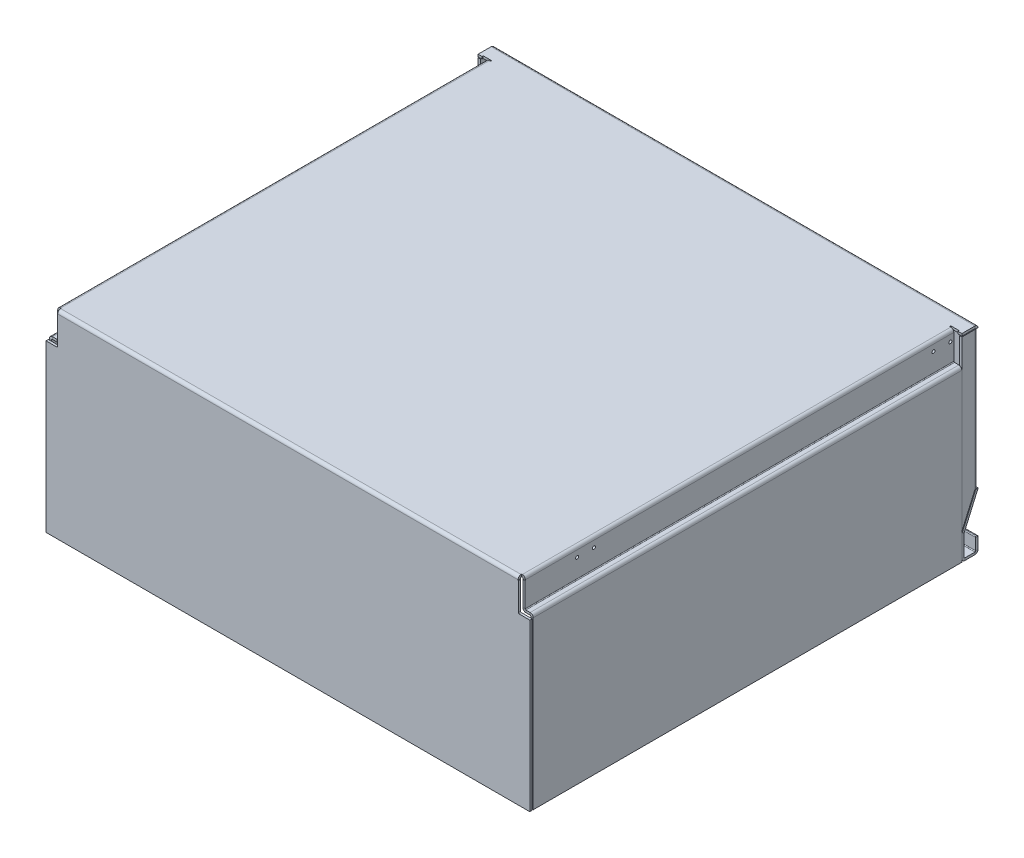
from build123d import *

# Parameters (mm, degrees)
DODANIE_WYCI_GNI_CIE1_DEPTH         = 565
DODANIE_WYCI_GNI_CIE2_DEPTH         = 632.58
KONWERTUJ_START                     = -896.862154084
KONWERTUJ_BRY_3_DEPTH               = 603.42
KONWERTUJ_START_2                   = -911.442154084
KONWERTUJ_BRY_3_2_DEPTH             = 632.58
KONWERTUJ_START_3                   = -566.5
KONWERTUJ_BRY_3_3_DEPTH             = 567.5
KONWERTUJ_START_4                   = -4.414213562
KONWERTUJ_BRY_3_4_DEPTH             = 5.414213562
KONWERTUJ_BRY_3_5_DEPTH             = 1.5
KONWERTUJ_START_5                   = -4.75
KONWERTUJ_BRY_3_6_DEPTH             = 0.335786438
KONWERTUJ_START_6                   = -565
KONWERTUJ_BRY_3_7_DEPTH             = 560.585786438
KONWERTUJ_START_7                   = -912
KONWERTUJ_BRY_3_8_DEPTH             = 634
KONWERTUJ_BRY_3_9_DEPTH             = 632.58
ODGI_CIE_KRAW_DZI1_STRIP_W          = 14
ODGI_CIE_KRAW_DZI1_STRIP_H          = 3
ODGI_CIE_KRAW_DZI1_STRIP_CUT_DEPTH  = 560.485786438
ODGI_CIE_KRAW_DZI1_RELIEF_W         = 15.5
ODGI_CIE_KRAW_DZI1_RELIEF_H         = 1.5
ODGI_CIE_KRAW_DZI1_RELIEF_CUT_DEPTH = 3
ODGI_CIE_KRAW_DZI1_DEPTH            = 560.485786438
ODGI_CIE_KRAW_DZI2_STRIP_W          = 14
ODGI_CIE_KRAW_DZI2_STRIP_H          = 3
ODGI_CIE_KRAW_DZI2_STRIP_CUT_DEPTH  = 560.485786438
ODGI_CIE_KRAW_DZI2_RELIEF_W         = 15.5
ODGI_CIE_KRAW_DZI2_RELIEF_H         = 1.5
ODGI_CIE_KRAW_DZI2_RELIEF_CUT_DEPTH = 3
ODGI_CIE_KRAW_DZI2_DEPTH            = 560.485786438
ODGI_CIE_KRAW_DZI3_STRIP_W          = 14
ODGI_CIE_KRAW_DZI3_STRIP_H          = 3
ODGI_CIE_KRAW_DZI3_STRIP_CUT_DEPTH  = 181.160616366
ODGI_CIE_KRAW_DZI3_DEPTH            = 181.160616366
DODANIE_WYCI_GNI_CIE9_DEPTH         = 3
ODGI_CIE_KRAW_DZI4_STRIP_W          = 14
ODGI_CIE_KRAW_DZI4_STRIP_H          = 3
ODGI_CIE_KRAW_DZI4_STRIP_CUT_DEPTH  = 181.160616366
ODGI_CIE_KRAW_DZI4_DEPTH            = 181.160616366
DODANIE_WYCI_GNI_CIE10_DEPTH        = 3
ZAOKR_GLENIE1_R                     = 1
SZKIC42_R                           = 2
WYTNIJ_WYCI_GNI_CIE1_DEPTH          = 888.463636929


with BuildPart() as part:
    # Szkic1 → Dodanie-wyciągnięcie1 (new body)
    with BuildSketch(Plane.XY):
        Polygon((-289.442154084, 19.601364099), (-289.442154084, -18), (-278.862154084, -18), (-278.862154084, -239.398635901), (-911.442154084, -239.398635901), (-911.442154084, -18), (-900.862154084, -18), (-900.862154084, 19.601364099), align=None)
    extrude(amount=-DODANIE_WYCI_GNI_CIE1_DEPTH)

    # Szkic2 → Dodanie-wyciągnięcie2 (add)
    with BuildSketch(Plane.ZY.offset(911.442154084)):
        Polygon((-565, 19.601364099), (-586, 19.601364099), (-586, -166.398635901), (-568, -207.398635901), (-568, -219.398635901), (-568, -236.398635901), (-583, -236.398635901), (-583, -219.398635901), (-586, -219.398635901), (-586, -239.398635901), (-565, -239.398635901), align=None)
    extrude(amount=-DODANIE_WYCI_GNI_CIE2_DEPTH)

    # Konwertuj bryłę3: read off the stored shape, not the designer's step
    # Konwertuj bryłę3 outline → Konwertuj bryłę3 (cut)
    with BuildSketch(Plane.YZ.offset(KONWERTUJ_START)):
        with BuildLine():
            ThreePointArc((16.601364099, -4), (16.30847088, -3.292893219), (15.601364099, -3))
            Line((15.601364099, -3), (-239.398635901, -3))
            Line((-239.398635901, -3), (-239.398635901, -569))
            ThreePointArc((-239.398635901, -569), (-238.227063026, -566.171572875), (-235.398635901, -565))
            Line((-235.398635901, -565), (-207.60848181, -565))
            ThreePointArc((-207.60848181, -565), (-206.78699063, -565.085264729), (-206.000521562, -565.337423879))
            Line((-206.000521562, -565.337423879), (-165.961242329, -582.91564403))
            ThreePointArc((-165.961242329, -582.91564403), (-165.764625062, -582.978683818), (-165.559252267, -583))
            Line((-165.559252267, -583), (15.601364099, -583))
            ThreePointArc((15.601364099, -583), (16.30847088, -582.707106781), (16.601364099, -582))
            Line((16.601364099, -582), (16.601364099, -4))
        make_face()
        with BuildLine():
            ThreePointArc((-235.398635901, -586), (-238.227063026, -584.828427125), (-239.398635901, -582))
            Line((-239.398635901, -582), (-239.398635901, -586))
            Line((-239.398635901, -586), (-235.398635901, -586))
        make_face()
    extrude(amount=KONWERTUJ_BRY_3_DEPTH, mode=Mode.SUBTRACT)

    # Konwertuj bry_3 2 outline → Konwertuj bry_3 2 (cut)
    with BuildSketch(Plane.YZ.offset(KONWERTUJ_START_2)):
        with BuildLine():
            Line((16.601364099, -565), (-21, -565))
            Line((-21, -565), (-21, -4.414213562))
            Line((-21, -4.414213562), (14.851364099, -4.414213562))
            Line((14.851364099, -4.414213562), (14.851364099, -4.75))
            Line((14.851364099, -4.75), (16.601364099, -4.75))
            Line((16.601364099, -4.75), (16.601364099, -4))
            ThreePointArc((16.601364099, -4), (16.30847088, -3.292893219), (15.601364099, -3))
            Line((15.601364099, -3), (-239.398635901, -3))
            Line((-239.398635901, -3), (-239.398635901, -569))
            ThreePointArc((-239.398635901, -569), (-238.227063026, -566.171572875), (-235.398635901, -565))
            Line((-235.398635901, -565), (-207.60848181, -565))
            ThreePointArc((-207.60848181, -565), (-206.78699063, -565.085264729), (-206.000521562, -565.337423879))
            Line((-206.000521562, -565.337423879), (-165.961242329, -582.91564403))
            ThreePointArc((-165.961242329, -582.91564403), (-165.764625062, -582.978683818), (-165.559252267, -583))
            Line((-165.559252267, -583), (15.601364099, -583))
            ThreePointArc((15.601364099, -583), (16.30847088, -582.707106781), (16.601364099, -582))
            Line((16.601364099, -582), (16.601364099, -565))
        make_face()
        with BuildLine():
            ThreePointArc((-235.398635901, -586), (-238.227063026, -584.828427125), (-239.398635901, -582))
            Line((-239.398635901, -582), (-239.398635901, -586))
            Line((-239.398635901, -586), (-235.398635901, -586))
        make_face()
    extrude(amount=KONWERTUJ_BRY_3_2_DEPTH, mode=Mode.SUBTRACT)

    # Konwertuj bry_3 3 outline → Konwertuj bry_3 3 (cut)
    with BuildSketch(Plane.XY.offset(KONWERTUJ_START_3)):
        with BuildLine():
            Line((-293.442154084, 16.601364099), (-294.192154084, 16.601364099))
            Line((-294.192154084, 16.601364099), (-294.192154084, 14.851364099))
            Line((-294.192154084, 14.851364099), (-293.856367646, 14.851364099))
            Line((-293.856367646, 14.851364099), (-293.856367646, -21.414213562))
            ThreePointArc((-293.856367646, -21.414213562), (-293.563474428, -22.121320343), (-292.856367646, -22.414213562))
            Line((-292.856367646, -22.414213562), (-278.862154084, -22.414213562))
            Line((-278.862154084, -22.414213562), (-278.862154084, -21))
            Line((-278.862154084, -21), (-288.442154084, -21))
            ThreePointArc((-288.442154084, -21), (-291.270581209, -19.828427125), (-292.442154084, -17))
            Line((-292.442154084, -17), (-292.442154084, 15.601364099))
            ThreePointArc((-292.442154084, 15.601364099), (-292.735047303, 16.30847088), (-293.442154084, 16.601364099))
        make_face()
        with BuildLine():
            ThreePointArc((-293.442154084, 19.601364099), (-290.61372696, 18.429791223), (-289.442154084, 15.601364099))
            Line((-289.442154084, 15.601364099), (-289.442154084, 16.601364099))
            Line((-289.442154084, 16.601364099), (-283.942154084, 16.601364099))
            Line((-283.942154084, 16.601364099), (-283.942154084, 19.601364099))
            Line((-283.942154084, 19.601364099), (-293.442154084, 19.601364099))
        make_face()
        with BuildLine():
            Line((-896.112154084, 16.601364099), (-896.862154084, 16.601364099))
            ThreePointArc((-896.862154084, 16.601364099), (-897.569260865, 16.30847088), (-897.862154084, 15.601364099))
            Line((-897.862154084, 15.601364099), (-897.862154084, -17))
            ThreePointArc((-897.862154084, -17), (-899.033726959, -19.828427125), (-901.862154084, -21))
            Line((-901.862154084, -21), (-911.442154084, -21))
            Line((-911.442154084, -21), (-911.442154084, -22.414213562))
            Line((-911.442154084, -22.414213562), (-897.447940521, -22.414213562))
            ThreePointArc((-897.447940521, -22.414213562), (-896.740833739, -22.121320343), (-896.447940521, -21.414213562))
            Line((-896.447940521, -21.414213562), (-896.447940521, 14.851364099))
            Line((-896.447940521, 14.851364099), (-896.112154084, 14.851364099))
            Line((-896.112154084, 14.851364099), (-896.112154084, 16.601364099))
        make_face()
        with BuildLine():
            Line((-896.862154084, 19.601364099), (-906.362154084, 19.601364099))
            Line((-906.362154084, 19.601364099), (-906.362154084, 16.601364099))
            Line((-906.362154084, 16.601364099), (-900.862154084, 16.601364099))
            Line((-900.862154084, 16.601364099), (-900.862154084, 15.601364099))
            ThreePointArc((-900.862154084, 15.601364099), (-899.690581209, 18.429791223), (-896.862154084, 19.601364099))
        make_face()
    extrude(amount=KONWERTUJ_BRY_3_3_DEPTH, mode=Mode.SUBTRACT)

    # Konwertuj bry_3 4 outline → Konwertuj bry_3 4 (cut)
    with BuildSketch(Plane.XY.offset(KONWERTUJ_START_4)):
        with BuildLine():
            Line((-293.442154084, 19.601364099), (-294.192154084, 19.601364099))
            Line((-294.192154084, 19.601364099), (-294.192154084, 16.601364099))
            Line((-294.192154084, 16.601364099), (-293.442154084, 16.601364099))
            ThreePointArc((-293.442154084, 16.601364099), (-292.735047303, 16.30847088), (-292.442154084, 15.601364099))
            Line((-292.442154084, 15.601364099), (-292.442154084, -17))
            ThreePointArc((-292.442154084, -17), (-291.270581209, -19.828427125), (-288.442154084, -21))
            Line((-288.442154084, -21), (-278.862154084, -21))
            Line((-278.862154084, -21), (-278.862154084, -18))
            Line((-278.862154084, -18), (-289.442154084, -18))
            Line((-289.442154084, -18), (-289.442154084, 15.601364099))
            ThreePointArc((-289.442154084, 15.601364099), (-290.61372696, 18.429791223), (-293.442154084, 19.601364099))
        make_face()
        with BuildLine():
            Line((-896.112154084, 16.601364099), (-896.112154084, 19.601364099))
            Line((-896.112154084, 19.601364099), (-896.862154084, 19.601364099))
            ThreePointArc((-896.862154084, 19.601364099), (-899.690581209, 18.429791223), (-900.862154084, 15.601364099))
            Line((-900.862154084, 15.601364099), (-900.862154084, -18))
            Line((-900.862154084, -18), (-911.442154084, -18))
            Line((-911.442154084, -18), (-911.442154084, -21))
            Line((-911.442154084, -21), (-901.862154084, -21))
            ThreePointArc((-901.862154084, -21), (-899.033726959, -19.828427125), (-897.862154084, -17))
            Line((-897.862154084, -17), (-897.862154084, 15.601364099))
            ThreePointArc((-897.862154084, 15.601364099), (-897.569260865, 16.30847088), (-896.862154084, 16.601364099))
            Line((-896.862154084, 16.601364099), (-896.112154084, 16.601364099))
        make_face()
    extrude(amount=KONWERTUJ_BRY_3_4_DEPTH, mode=Mode.SUBTRACT)

    # Konwertuj bry_3 5 outline → Konwertuj bry_3 5 (cut)
    with BuildSketch(Plane.XY.offset(KONWERTUJ_START_3)):
        with BuildLine():
            Line((-294.942154084, 19.601364099), (-294.942154084, 16.601364099))
            Line((-294.942154084, 16.601364099), (-289.569170738, 16.601364099))
            ThreePointArc((-289.569170738, 16.601364099), (-290.992664341, 18.763641759), (-293.442154084, 19.601364099))
            Line((-293.442154084, 19.601364099), (-294.942154084, 19.601364099))
        make_face()
        with BuildLine():
            Line((-895.362154084, 16.601364099), (-895.362154084, 19.601364099))
            Line((-895.362154084, 19.601364099), (-896.862154084, 19.601364099))
            ThreePointArc((-896.862154084, 19.601364099), (-899.311643827, 18.763641759), (-900.73513743, 16.601364099))
            Line((-900.73513743, 16.601364099), (-895.362154084, 16.601364099))
        make_face()
    extrude(amount=KONWERTUJ_BRY_3_5_DEPTH, mode=Mode.SUBTRACT)

    # Konwertuj bry_3 6 outline → Konwertuj bry_3 6 (cut)
    with BuildSketch(Plane.XY.offset(KONWERTUJ_START_5)):
        with BuildLine():
            Line((-293.442154084, 19.601364099), (-294.192154084, 19.601364099))
            Line((-294.192154084, 19.601364099), (-294.192154084, 16.601364099))
            Line((-294.192154084, 16.601364099), (-289.569170738, 16.601364099))
            ThreePointArc((-289.569170738, 16.601364099), (-290.992664341, 18.763641759), (-293.442154084, 19.601364099))
        make_face()
        with BuildLine():
            Line((-896.112154084, 16.601364099), (-896.112154084, 19.601364099))
            Line((-896.112154084, 19.601364099), (-896.862154084, 19.601364099))
            ThreePointArc((-896.862154084, 19.601364099), (-899.311643827, 18.763641759), (-900.73513743, 16.601364099))
            Line((-900.73513743, 16.601364099), (-896.112154084, 16.601364099))
        make_face()
    extrude(amount=KONWERTUJ_BRY_3_6_DEPTH, mode=Mode.SUBTRACT)

    # Konwertuj bry_3 7 outline → Konwertuj bry_3 7 (add)
    with BuildSketch(Plane.XY.offset(KONWERTUJ_START_6)):
        with BuildLine():
            ThreePointArc((-288.442154084, -18), (-289.149260865, -17.707106781), (-289.442154084, -17))
            Line((-289.442154084, -17), (-289.442154084, -18))
            Line((-289.442154084, -18), (-288.442154084, -18))
        make_face()
        with BuildLine():
            Line((-900.862154084, -18), (-900.862154084, -17))
            ThreePointArc((-900.862154084, -17), (-901.155047303, -17.707106781), (-901.862154084, -18))
            Line((-901.862154084, -18), (-900.862154084, -18))
        make_face()
    extrude(amount=KONWERTUJ_BRY_3_7_DEPTH)

    # Konwertuj bry_3 8 outline → Konwertuj bry_3 8 (cut)
    with BuildSketch(Plane.YZ.offset(KONWERTUJ_START_7)):
        with BuildLine():
            ThreePointArc((15.601364099, 0), (18.429791224, -1.171572876), (19.601364099, -4))
            Line((19.601364099, -4), (19.601364099, 0))
            Line((19.601364099, 0), (15.601364099, 0))
        make_face()
        with BuildLine():
            ThreePointArc((19.601364099, -582), (18.429791223, -584.828427124), (15.601364099, -586))
            Line((15.601364099, -586), (19.601364099, -586))
            Line((19.601364099, -586), (19.601364099, -582))
        make_face()
        with BuildLine():
            ThreePointArc((-165.559252267, -586), (-166.380743447, -585.914735271), (-167.167212515, -585.662576121))
            Line((-167.167212515, -585.662576121), (-166.398635901, -586))
            Line((-166.398635901, -586), (-165.559252267, -586))
        make_face()
    extrude(amount=KONWERTUJ_BRY_3_8_DEPTH, mode=Mode.SUBTRACT)

    # Konwertuj bry_3 9 outline → Konwertuj bry_3 9 (add)
    with BuildSketch(Plane.YZ.offset(KONWERTUJ_START_2)):
        with BuildLine():
            Line((-207.398635901, -568), (-207.60848181, -568))
            ThreePointArc((-207.60848181, -568), (-207.403109015, -568.021316182), (-207.206491748, -568.08435597))
            Line((-207.206491748, -568.08435597), (-207.398635901, -568))
        make_face()
        with BuildLine():
            Line((-236.398635901, -568), (-236.398635901, -569))
            ThreePointArc((-236.398635901, -569), (-236.105742682, -568.292893219), (-235.398635901, -568))
            Line((-235.398635901, -568), (-236.398635901, -568))
        make_face()
        with BuildLine():
            ThreePointArc((-235.398635901, -583), (-236.105742682, -582.707106781), (-236.398635901, -582))
            Line((-236.398635901, -582), (-236.398635901, -583))
            Line((-236.398635901, -583), (-235.398635901, -583))
        make_face()
    extrude(amount=KONWERTUJ_BRY_3_9_DEPTH)

    # Odgięcie krawędzi1: sheet metal written as solids
    # Odgięcie krawędzi1 strip (on a plane across the edge) → Odgięcie krawędzi1 strip cut (cut)
    with BuildSketch(Plane(origin=(-911.442154084, -21, -4.414213562), x_dir=(1, 0, 0), z_dir=(0, 0, -1))):
        with Locations((-3, -1.5)):
            Rectangle(ODGI_CIE_KRAW_DZI1_STRIP_W, ODGI_CIE_KRAW_DZI1_STRIP_H)
    extrude(amount=ODGI_CIE_KRAW_DZI1_STRIP_CUT_DEPTH, mode=Mode.SUBTRACT)

    # Odgięcie krawędzi1 relief (on the sheet) → Odgięcie krawędzi1 relief cut (cut)
    with BuildSketch(Plane(origin=(-907.442154084, -21, -4.414213562), x_dir=(1, 0, 0), z_dir=(0, -1, 0))):
        with Locations((-6.25, -561.235786438)):
            Rectangle(ODGI_CIE_KRAW_DZI1_RELIEF_W, ODGI_CIE_KRAW_DZI1_RELIEF_H)
    extrude(amount=-ODGI_CIE_KRAW_DZI1_RELIEF_CUT_DEPTH, mode=Mode.SUBTRACT)

    # Odgięcie krawędzi1 section (on a plane across the edge) → Odgięcie krawędzi1 (add)
    with BuildSketch(Plane(origin=(-911.442154084, -21, -4.414213562), x_dir=(1, 0, 0), z_dir=(0, 0, -1))):
        with BuildLine():
            Line((0, 1), (0, 218.398635901))
            Line((0, 218.398635901), (3, 218.398635901))
            Line((3, 218.398635901), (3, 1))
            ThreePointArc((3, 1), (3.292893219, 0.292893219), (4, 0))
            Line((4, 0), (4, -3))
            ThreePointArc((4, -3), (1.171572875, -1.828427125), (0, 1))
        make_face()
    extrude(amount=ODGI_CIE_KRAW_DZI1_DEPTH)

    # Odgięcie krawędzi2: sheet metal written as solids
    # Odgięcie krawędzi2 strip (on a plane across the edge) → Odgięcie krawędzi2 strip cut (cut)
    with BuildSketch(Plane(origin=(-278.862154084, -21, -564.9), x_dir=(-1, 0, 0), z_dir=(0, 0, 1))):
        with Locations((-3, -1.5)):
            Rectangle(ODGI_CIE_KRAW_DZI2_STRIP_W, ODGI_CIE_KRAW_DZI2_STRIP_H)
    extrude(amount=ODGI_CIE_KRAW_DZI2_STRIP_CUT_DEPTH, mode=Mode.SUBTRACT)

    # Odgięcie krawędzi2 relief (on the sheet) → Odgięcie krawędzi2 relief cut (cut)
    with BuildSketch(Plane(origin=(-282.862154084, -21, -564.9), x_dir=(-1, 0, 0), z_dir=(0, -1, 0))):
        with Locations((-6.25, 0.75)):
            Rectangle(ODGI_CIE_KRAW_DZI2_RELIEF_W, ODGI_CIE_KRAW_DZI2_RELIEF_H)
    extrude(amount=-ODGI_CIE_KRAW_DZI2_RELIEF_CUT_DEPTH, mode=Mode.SUBTRACT)

    # Odgięcie krawędzi2 section (on a plane across the edge) → Odgięcie krawędzi2 (add)
    with BuildSketch(Plane(origin=(-278.862154084, -21, -564.9), x_dir=(-1, 0, 0), z_dir=(0, 0, 1))):
        with BuildLine():
            Line((0, 1), (0, 218.398635901))
            Line((0, 218.398635901), (3, 218.398635901))
            Line((3, 218.398635901), (3, 1))
            ThreePointArc((3, 1), (3.292893219, 0.292893219), (4, 0))
            Line((4, 0), (4, -3))
            ThreePointArc((4, -3), (1.171572875, -1.828427125), (0, 1))
        make_face()
    extrude(amount=ODGI_CIE_KRAW_DZI2_DEPTH)

    # Odgięcie krawędzi3: sheet metal written as solids
    # Odgięcie krawędzi3 strip (on a plane across the edge) → Odgięcie krawędzi3 strip cut (cut)
    with BuildSketch(Plane(origin=(-278.862154084, -165.559252267, -583), x_dir=(-1, 0, 0), z_dir=(0, 1, 0))):
        with Locations((-3, -1.5)):
            Rectangle(ODGI_CIE_KRAW_DZI3_STRIP_W, ODGI_CIE_KRAW_DZI3_STRIP_H)
    extrude(amount=ODGI_CIE_KRAW_DZI3_STRIP_CUT_DEPTH, mode=Mode.SUBTRACT)

    # Odgięcie krawędzi3 section (on a plane across the edge) → Odgięcie krawędzi3 (add)
    with BuildSketch(Plane(origin=(-278.862154084, -165.559252267, -583), x_dir=(-1, 0, 0), z_dir=(0, 1, 0))):
        with BuildLine():
            Line((0, 1), (0, 18))
            Line((0, 18), (3, 18))
            Line((3, 18), (3, 1))
            ThreePointArc((3, 1), (3.292893219, 0.292893219), (4, 0))
            Line((4, 0), (4, -3))
            ThreePointArc((4, -3), (1.171572875, -1.828427125), (0, 1))
        make_face()
    extrude(amount=ODGI_CIE_KRAW_DZI3_DEPTH)

    # Szkic32 → Dodanie-wyciągnięcie9 (add)
    with BuildSketch(Plane(origin=(-278.862154084, 0, 0), x_dir=(0, 0, -1), z_dir=(1, 0, 0))):
        Polygon((582, -165.559252267), (565, -204.281474489), (565, -165.559252267), align=None)
    extrude(amount=-DODANIE_WYCI_GNI_CIE9_DEPTH)

    # Odgięcie krawędzi4: sheet metal written as solids
    # Odgięcie krawędzi4 strip (on a plane across the edge) → Odgięcie krawędzi4 strip cut (cut)
    with BuildSketch(Plane(origin=(-911.442154084, 15.601364099, -583), x_dir=(1, 0, 0), z_dir=(0, -1, 0))):
        with Locations((-3, -1.5)):
            Rectangle(ODGI_CIE_KRAW_DZI4_STRIP_W, ODGI_CIE_KRAW_DZI4_STRIP_H)
    extrude(amount=ODGI_CIE_KRAW_DZI4_STRIP_CUT_DEPTH, mode=Mode.SUBTRACT)

    # Odgięcie krawędzi4 section (on a plane across the edge) → Odgięcie krawędzi4 (add)
    with BuildSketch(Plane(origin=(-911.442154084, 15.601364099, -583), x_dir=(1, 0, 0), z_dir=(0, -1, 0))):
        with BuildLine():
            Line((0, 1), (0, 18))
            Line((0, 18), (3, 18))
            Line((3, 18), (3, 1))
            ThreePointArc((3, 1), (3.292893219, 0.292893219), (4, 0))
            Line((4, 0), (4, -3))
            ThreePointArc((4, -3), (1.171572875, -1.828427125), (0, 1))
        make_face()
    extrude(amount=ODGI_CIE_KRAW_DZI4_DEPTH)

    # Szkic36 → Dodanie-wyciągnięcie10 (add)
    with BuildSketch(Plane.ZY.offset(911.442154084)):
        Polygon((-582, -165.559252267), (-565, -165.559252267), (-565, -204.281474489), align=None)
    extrude(amount=-DODANIE_WYCI_GNI_CIE10_DEPTH)

    # Zaokrąglenie1
    zaokr_glenie1_edges = [part.edges().sort_by_distance(p)[0] for p in [
        (-595.152154084, -219.398635901, -583),
        (-595.152154084, -219.398635901, -586),
        (-911.442154084, -219.398635901, -584.5),
        (-278.862154084, -219.398635901, -584.5),
    ]]
    fillet(zaokr_glenie1_edges, radius=ZAOKR_GLENIE1_R)

    # Szkic42 → Wytnij-wyciągnięcie1 (cut, through all)
    with BuildSketch(Plane.ZY.offset(900.862154084)):
        with Locations((-560.414213563, 7.101364103)):
            Circle(SZKIC42_R)
        with Locations((-538.414213563, 7.101364103)):
            Circle(SZKIC42_R)
        with Locations((-72.414213563, 7.101364103)):
            Circle(SZKIC42_R)
        with Locations((-94.414213563, 7.101364103)):
            Circle(SZKIC42_R)
    extrude(amount=-WYTNIJ_WYCI_GNI_CIE1_DEPTH, mode=Mode.SUBTRACT)


solid = part.part
